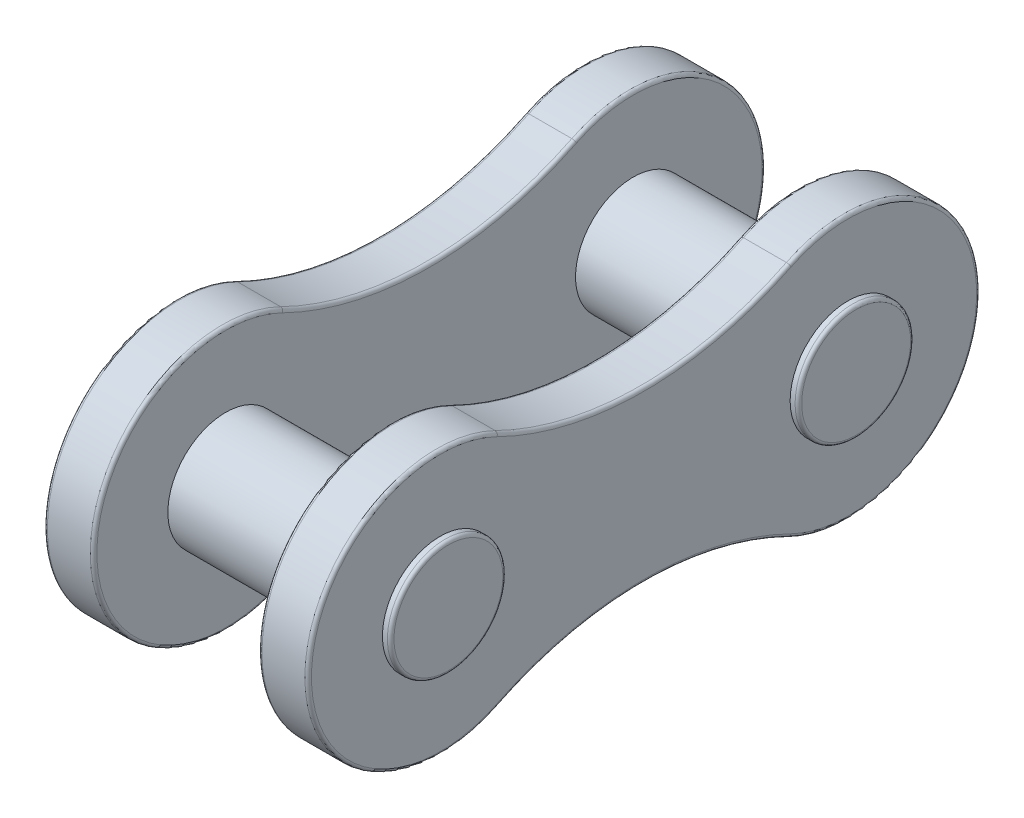
from build123d import *

# Parameters (mm, degrees)
BOSS_EXTRUDE2_START = 2500
SKETCH5_R           = 1750
BOSS_EXTRUDE2_DEPTH = 1500
BOSS_EXTRUDE3_START = -2500
SKETCH6_R           = 1750
BOSS_EXTRUDE3_DEPTH = 1500
SKETCH7_R           = 1750
BOSS_EXTRUDE4_DEPTH = 4250
FILLET1_R           = 100


with BuildPart() as part:
    # Sketch5 → Boss-Extrude2 (new body)
    with BuildSketch(Plane(origin=(0, 0, 0), x_dir=(0, 0, -1), z_dir=(1, 0, 0)).offset(BOSS_EXTRUDE2_START)):
        with BuildLine():
            ThreePointArc((-4410.714285714, 3589.888009168), (-10175, 0), (-4410.714285714, -3589.888009168))
            ThreePointArc((-4410.714285714, -3589.888009168), (0, -2564.608032088), (4410.714285714, -3589.888009168))
            ThreePointArc((4410.714285714, -3589.888009168), (10175, 0), (4410.714285714, 3589.888009168))
            ThreePointArc((4410.714285714, 3589.888009168), (0, 2564.608032088), (-4410.714285714, 3589.888009168))
        make_face()
        with Locations((-6175, 0)):
            Circle(SKETCH5_R, mode=Mode.SUBTRACT)
        with Locations((6175, 0)):
            Circle(SKETCH5_R, mode=Mode.SUBTRACT)
    extrude(amount=BOSS_EXTRUDE2_DEPTH)



with BuildPart() as body_2:
    # Sketch6 → Boss-Extrude3 (new body)
    with BuildSketch(Plane(origin=(0, 0, 0), x_dir=(0, 0, -1), z_dir=(1, 0, 0)).offset(BOSS_EXTRUDE3_START)):
        with BuildLine():
            ThreePointArc((-4410.714285714, 3589.888009168), (0, 2564.608032088), (4410.714285714, 3589.888009168))
            ThreePointArc((4410.714285714, 3589.888009168), (10175, 0), (4410.714285714, -3589.888009168))
            ThreePointArc((4410.714285714, -3589.888009168), (0, -2564.608032088), (-4410.714285714, -3589.888009168))
            ThreePointArc((-4410.714285714, -3589.888009168), (-10175, 0), (-4410.714285714, 3589.888009168))
        make_face()
        with Locations((6175, 0)):
            Circle(SKETCH6_R, mode=Mode.SUBTRACT)
        with Locations((-6175, 0)):
            Circle(SKETCH6_R, mode=Mode.SUBTRACT)
    extrude(amount=-BOSS_EXTRUDE3_DEPTH)


with BuildPart() as part_1:
    add(part.part)

    add(body_2.part)  # Boss-Extrude4 merges body 2
    # Sketch7 → Boss-Extrude4 (add, symmetric)
    with BuildSketch(Plane(origin=(0, 0, 0), x_dir=(0, 0, -1), z_dir=(1, 0, 0))):
        with Locations((6175, 0)):
            Circle(SKETCH7_R)
        with Locations((-6175, 0)):
            Circle(SKETCH7_R)
    extrude(amount=BOSS_EXTRUDE4_DEPTH, both=True)

    # Fillet1
    fillet1_edges = [part_1.edges().sort_by_distance(p)[0] for p in [
        (4000, 0, -10175),
        (4000, -2564.608032088, 0),
        (4000, 0, 10175),
        (2500, 0, -10175),
        (2500, -2564.608032088, 0),
        (2500, 0, 10175),
        (-4000, 0, -10175),
        (-4000, -2564.608032088, 0),
        (-4000, 0, 10175),
        (-2500, 0, -10175),
        (-2500, -2564.608032088, 0),
        (-2500, 0, 10175),
        (4000, 2564.608032088, 0),
        (2500, 2564.608032088, 0),
        (-4000, 2564.608032088, 0),
        (-2500, 2564.608032088, 0),
        (-4250, 0, -4425),
        (-4250, 0, 7925),
        (4250, 0, -4425),
        (4250, 0, 7925),
    ]]
    fillet(fillet1_edges, radius=FILLET1_R)


solid = part_1.part
